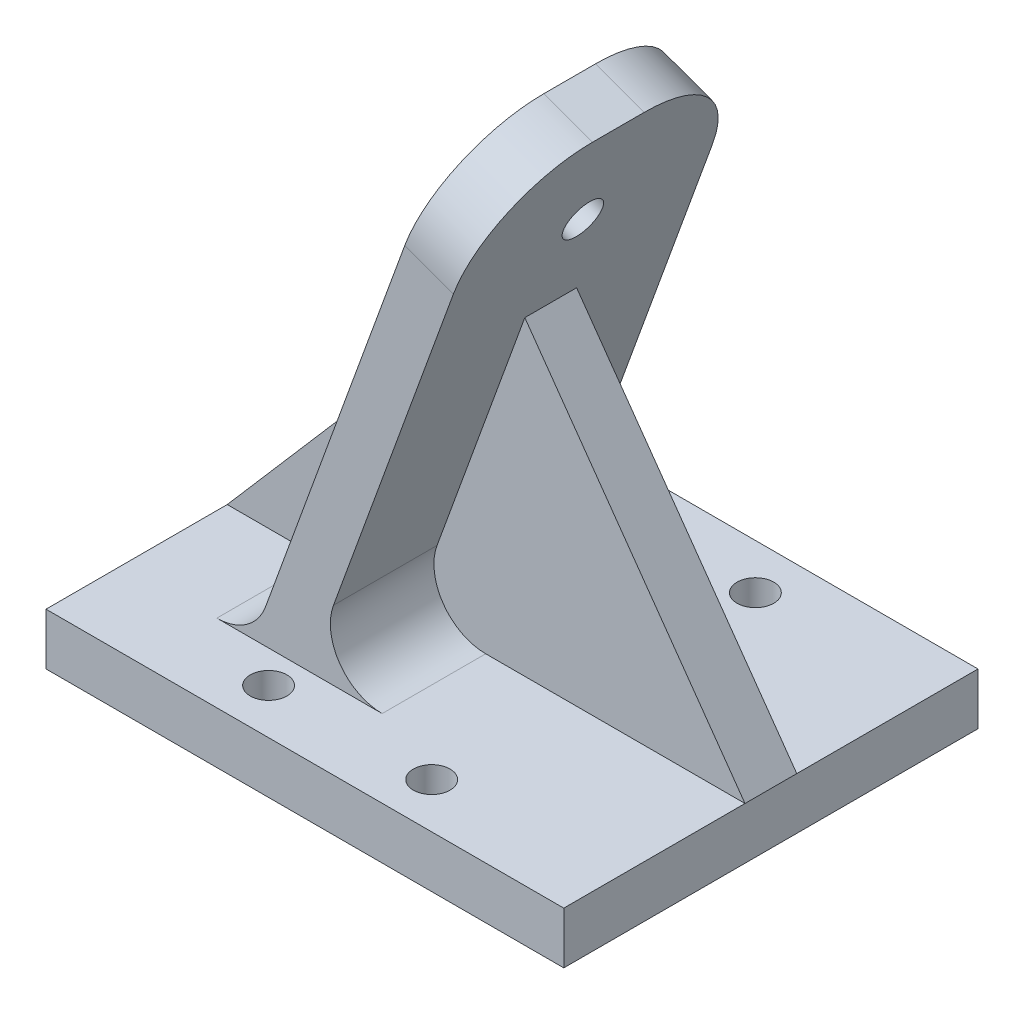
from build123d import *

# Parameters (mm, degrees)
SKETCH1_W           = 63.5
SKETCH1_H           = 50.8
BOSS_EXTRUDE1_DEPTH = 6.35
BOSS_EXTRUDE2_DEPTH = 15.875
FILLET1_R           = 12.7
FILLET2_R           = 6.35
BOSS_EXTRUDE5_DEPTH = 3.175
SKETCH5_R           = 2.413
CUT_EXTRUDE3_DEPTH  = 84.482225581
SKETCH8_R           = 2.25
CUT_EXTRUDE4_DEPTH  = 76.017772125


with BuildPart() as part:
    # Sketch1 → Boss-Extrude1 (new body)
    with BuildSketch(Plane(origin=(0, 0, 0), x_dir=(1, 0, 0), z_dir=(0, 1, 0))):
        Rectangle(SKETCH1_W, SKETCH1_H)
    extrude(amount=BOSS_EXTRUDE1_DEPTH)

    # Sketch2 → Boss-Extrude2 (add, symmetric)
    with BuildSketch(Plane.XY):
        Polygon((-11.43, 0), (13.036574415, 67.221360736), (7.069526273, 69.393188646), (-17.397048142, 2.17182791), align=None)
    extrude(amount=BOSS_EXTRUDE2_DEPTH, both=True)

    # Fillet1
    fillet1_edges = [part.edges().sort_by_distance(p)[0] for p in [
        (10.053050344, 68.307274691, 15.875),
        (10.053050344, 68.307274691, -15.875),
    ]]
    fillet(fillet1_edges, radius=FILLET1_R)

    # Fillet2
    fillet2_edges = [part.edges().sort_by_distance(p)[0] for p in [
        (-15.876317868, 6.35, 0),
        (-9.118789012, 6.35, 0),
    ]]
    fillet(fillet2_edges, radius=FILLET2_R)

    # Sketch7 → Boss-Extrude5 (add, symmetric)
    with BuildSketch(Plane.XY):
        with BuildLine():
            Line((4.748476913, 44.45), (31.75, 6.35))
            Line((31.75, 6.35), (-0.05004917, 6.35))
            ThreePointArc((-0.05004917, 6.35), (-5.251664651, 9.057789629), (-6.017097312, 14.87182791))
            Line((-6.017097312, 14.87182791), (4.748476913, 44.45))
        make_face()
        with BuildLine():
            Line((-31.75, 6.35), (-20.322635735, 6.35))
            ThreePointArc((-20.322635735, 6.35), (-16.680425364, 7.498384519), (-14.355587593, 10.52817209))
            Line((-14.355587593, 10.52817209), (-4.32026293, 38.1))
            Line((-4.32026293, 38.1), (-31.75, 6.35))
        make_face()
    extrude(amount=BOSS_EXTRUDE5_DEPTH, both=True)

    # Sketch5 → Cut-Extrude3 (cut, through all)
    with BuildSketch(Plane(origin=(-16.059992134, 5.845359099, 0), x_dir=(0, 0, 1), z_dir=(-0.9396926207859105, 0.34202014332566305, 0))):
        with Locations((0, 54.926187693)):
            Circle(SKETCH5_R)
    extrude(amount=-CUT_EXTRUDE3_DEPTH, mode=Mode.SUBTRACT)

    # Sketch8 → Cut-Extrude4 (cut, through all)
    with BuildSketch(Plane(origin=(0, 6.35, 0), x_dir=(1, 0, 0), z_dir=(0, 1, 0))):
        with Locations((10, -19.85)):
            Circle(SKETCH8_R)
        with Locations((10, 19.85)):
            Circle(SKETCH8_R)
        with Locations((-10, 19.85)):
            Circle(SKETCH8_R)
        with Locations((-10, -19.85)):
            Circle(SKETCH8_R)
    extrude(amount=-CUT_EXTRUDE4_DEPTH, mode=Mode.SUBTRACT)


solid = part.part
